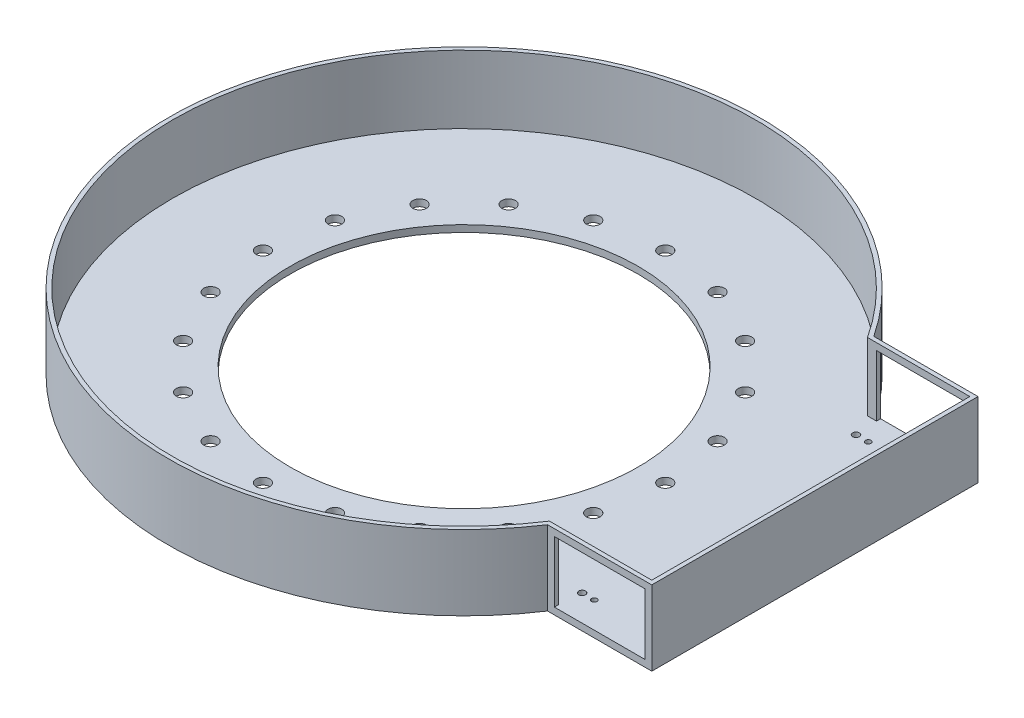
from build123d import *

# Parameters (mm, degrees)
ESQUISSE1_W                  = 80
ESQUISSE1_H                  = 10
ESQUISSE3_R                  = 10
ENL_V_MAT_EXTRU_1_DEPTH      = 476.280969533
R_P_TITION_CIRCULAIRE1_COUNT = 20
BOSS_EXTRU_1_START           = -10
BOSS_EXTRU_1_DEPTH           = 10
BOSS_EXTRU_2_START           = -10
BOSS_EXTRU_2_DEPTH           = 10
BOSS_EXTRU_3_START           = 100
BOSS_EXTRU_3_DEPTH           = 100
ESQUISSE8_W                  = 133.349416634
ESQUISSE8_H                  = 90
ENL_V_MAT_EXTRU_2_DEPTH      = 857.817874815
ESQUISSE9_R                  = 5
ESQUISSE9_R_2                = 4
ENL_V_MAT_EXTRU_3_DEPTH      = 683.375901247


with BuildPart() as part:
    # Esquisse1 → Révolution1 (revolve)
    with BuildSketch(Plane.XY):
        with Locations((296, 5)):
            Rectangle(ESQUISSE1_W, ESQUISSE1_H)
    revolve(axis=Axis((0, 0, 0), (0, 1, 0)))

    # Esquisse3 → Enlèv. mat.-Extru.1 (cut, through all)
    with BuildSketch(Plane(origin=(0, 10, 0), x_dir=(1, 0, 0), z_dir=(0, 1, 0))):
        with Locations((296, 0)):
            Circle(ESQUISSE3_R)
    enl_v_mat_extru_1 = extrude(amount=-ENL_V_MAT_EXTRU_1_DEPTH, mode=Mode.SUBTRACT)

    # Répétition circulaire1: Enlèv. mat.-Extru.1 ×20 about axis
    r_p_tition_circulaire1_axis = Axis((0, 0, 0), (0, -1, 0))
    for i in range(1, R_P_TITION_CIRCULAIRE1_COUNT):
        add(enl_v_mat_extru_1.rotate(r_p_tition_circulaire1_axis, i * 360 / R_P_TITION_CIRCULAIRE1_COUNT), mode=Mode.SUBTRACT)

    # Esquisse4 → Boss.-Extru.1 (add)
    with BuildSketch(Plane.XZ.offset(BOSS_EXTRU_1_START)):
        with BuildLine():
            Line((516.151015307, -240), (516.151015307, 240))
            Line((516.151015307, 240), (235.151015307, 240))
            ThreePointArc((235.151015307, 240), (336, 0), (235.151015307, -240))
            Line((235.151015307, -240), (516.151015307, -240))
        make_face()
    extrude(amount=BOSS_EXTRU_1_DEPTH)

    # Esquisse5 → Boss.-Extru.2 (add)
    with BuildSketch(Plane.XZ.offset(BOSS_EXTRU_2_START)):
        with BuildLine():
            Line((235.151015307, -240), (362.801598673, -240))
            ThreePointArc((362.801598673, -240), (-435, 0), (362.801598673, 240))
            Line((362.801598673, 240), (235.151015307, 240))
            ThreePointArc((235.151015307, 240), (-336, 0), (235.151015307, -240))
        make_face()
    extrude(amount=BOSS_EXTRU_2_DEPTH)

    # Esquisse6 → Boss.-Extru.3 (add)
    with BuildSketch(Plane(origin=(0, 10, 0), x_dir=(1, 0, 0), z_dir=(0, 1, 0)).offset(BOSS_EXTRU_3_START)):
        with BuildLine():
            Line((516.151015307, 240), (362.801598673, 240))
            ThreePointArc((362.801598673, 240), (-435, 0), (362.801598673, -240))
            Line((362.801598673, -240), (516.151015307, -240))
            Line((516.151015307, -240), (516.151015307, 240))
        make_face()
        with BuildLine():
            Line((510.151015307, -234), (359.562233834, -234))
            ThreePointArc((359.562233834, -234), (-429, 0), (359.562233834, 234))
            Line((359.562233834, 234), (510.151015307, 234))
            Line((510.151015307, 234), (510.151015307, -234))
        make_face(mode=Mode.SUBTRACT)
    extrude(amount=-BOSS_EXTRU_3_DEPTH)

    # Esquisse8 → Enlèv. mat.-Extru.2 (cut, through all)
    with BuildSketch(Plane.XY.offset(240)):
        with Locations((439.47630699, 55)):
            Rectangle(ESQUISSE8_W, ESQUISSE8_H)
    extrude(amount=-ENL_V_MAT_EXTRU_2_DEPTH, mode=Mode.SUBTRACT)

    # Esquisse9 → Enlèv. mat.-Extru.3 (cut, through all)
    with BuildSketch(Plane(origin=(0, 10, 0), x_dir=(1, 0, 0), z_dir=(0, 1, 0))):
        with Locations((500.151015307, -201.5)):
            Circle(ESQUISSE9_R)
        with Locations((375.151015307, -201.5)):
            Circle(ESQUISSE9_R)
        with Locations((393.151015307, -201.5)):
            Circle(ESQUISSE9_R_2)
        with Locations((482.151015307, -201.5)):
            Circle(ESQUISSE9_R_2)
        with Locations((375.151015307, 201.5)):
            Circle(ESQUISSE9_R)
        with Locations((393.151015307, 201.5)):
            Circle(ESQUISSE9_R_2)
        with Locations((482.151015307, 201.5)):
            Circle(ESQUISSE9_R_2)
        with Locations((500.151015307, 201.5)):
            Circle(ESQUISSE9_R)
    extrude(amount=-ENL_V_MAT_EXTRU_3_DEPTH, mode=Mode.SUBTRACT)


solid = part.part
